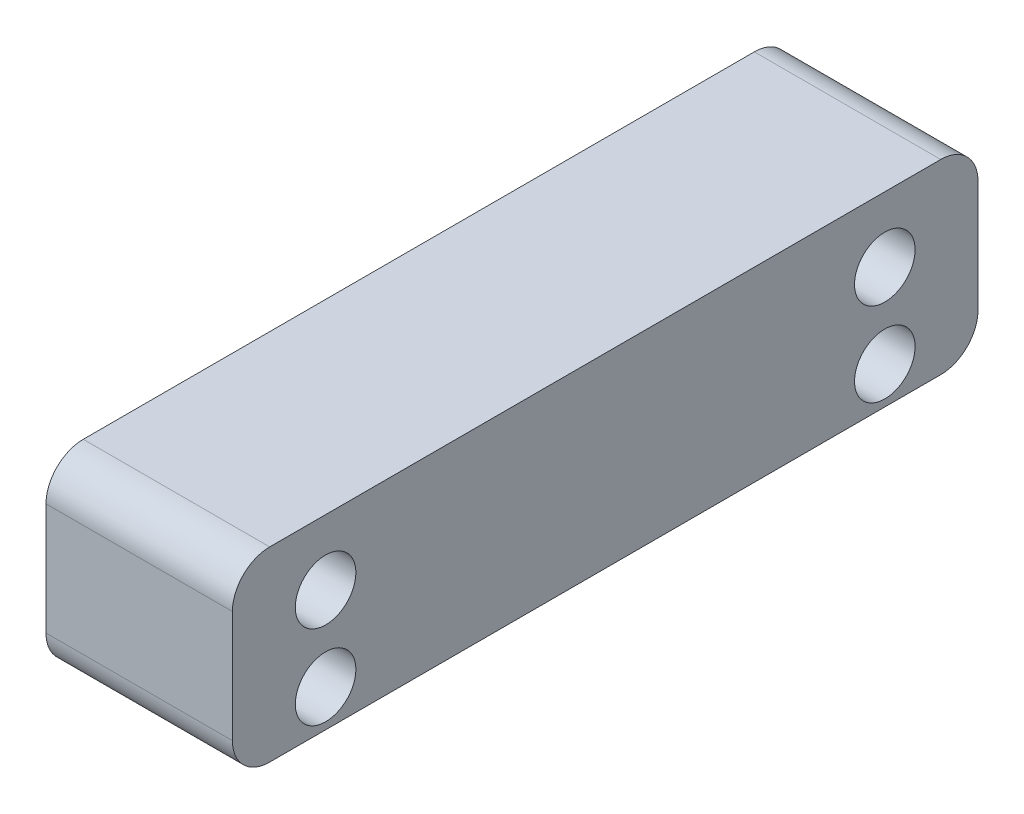
from build123d import *

# Parameters (mm, degrees)
BOSS_EXTRUDE1_DEPTH      = 90
FILLET1_R                = 7.5
FILLET2_R                = 2
SKETCH2_W                = 20
SKETCH2_H                = 80
SKETCH2_W_2              = 32
BOSS_EXTRUDE2_DEPTH      = 20
SKETCH3_R                = 2.5
BOSS_EXTRUDE3_DEPTH      = 111
BOSS_EXTRUDE4_START      = 7.5
SKETCH4_W                = 80
SKETCH4_H                = 20
SKETCH4_R                = 3.25
BOSS_EXTRUDE4_DEPTH      = 20
MOVE_FACE1_BY            = 1.5
MOVE_FACE2_BY            = 1.5
FILLET3_R                = 4
FILLET4_R                = 4
CUT_EXTRUDE1_DEPTH       = 2
BOSS_EXTRUDE5_DEPTH      = 2
SKETCH7_W                = 58
SKETCH7_H                = 15
CUT_EXTRUDE2_DEPTH       = 0.5
SKETCH8_R                = 10
BOSS_EXTRUDE6_DEPTH      = 1.5
SKETCH10_R               = 4.25
SKETCH10_R_2             = 2.75
CUT_EXTRUDE_THIN1_DEPTH  = 1.5
SKETCH11_RX              = 5
SKETCH11_RY              = 2.5
BOSS_EXTRUDE7_DEPTH      = 1.5
LPATTERN1_COUNT          = 3
LPATTERN1_PITCH          = 24
SKETCH12_RX              = 5
SKETCH12_RY              = 2.5
BOSS_EXTRUDE8_DEPTH      = 1.5
LPATTERN2_START          = 113.13708499
LPATTERN2_DEPTH          = 1.5
FILLET7_R                = 7.5
FILLET5_R                = 5
FILLET6_R                = 2
SHELL1_T                 = -1
SKETCH14_R               = 14
BOSS_EXTRUDE9_DEPTH      = 1
BOSS_EXTRUDE10_DEPTH     = 1
BOSS_EXTRUDE11_START     = -30
BOSS_EXTRUDE11_OUTLINE_R = 13
BOSS_EXTRUDE11_DEPTH     = 10
BOSS_EXTRUDE12_REACH     = 233.484
SKETCH18_R               = 3
SKETCH17_W               = 1.5
SKETCH17_H               = 20
SKETCH17_W_2             = 20
SKETCH17_H_2             = 1.5
EXTRUDE_THIN1_DEPTH      = 63.5
SKETCH20_R               = 12.5
BOSS_EXTRUDE13_DEPTH     = 5
FILLET8_R                = 2


# Read off the part's stored shape, not the designer's step: LPattern2, Body-Move/Copy1, Boss-Extrude11
with BuildPart() as part:
    # Sketch1 → Boss-Extrude1 (new, symmetric)
    with BuildSketch(Plane(origin=(0, 0, 0), x_dir=(0, 0, -1), z_dir=(1, 0, 0))):
        Polygon((0, 0), (0, 45), (-115, 45), (-160, 0), align=None)
    extrude(amount=BOSS_EXTRUDE1_DEPTH, both=True)

    # Fillet1
    fillet1_edges = [part.edges().sort_by_distance(p)[0] for p in [
        (0, 0, 160),
        (0, 45, 115),
        (0, 45, 0),
        (0, 0, 0),
    ]]
    fillet(fillet1_edges, radius=FILLET1_R)

    # Fillet2
    fillet2_edges = [part.edges().sort_by_distance(p)[0] for p in [
        (-90, 0, 74.696699141),
        (90, 0, 74.696699141),
        (-90, 27.803300859, 132.196699141),
        (-90, 45, 59.696699141),
        (-90, 22.5, 0),
        (-90, 44.429096494, 114.763524025),
        (-90, 2.196699141, 2.196699141),
        (-90, 42.803300859, 2.196699141),
        (-90, 4.629874257, 148.822494776),
        (90, 27.803300859, 132.196699141),
        (90, 22.5, 0),
        (90, 45, 59.696699141),
        (90, 44.429096494, 114.763524025),
        (90, 2.196699141, 2.196699141),
        (90, 42.803300859, 2.196699141),
        (90, 4.629874257, 148.822494776),
    ]]
    fillet(fillet2_edges, radius=FILLET2_R)

    # Sketch2 → Boss-Extrude2 (add)
    with BuildSketch(Plane(origin=(0, 45, 0), x_dir=(1, 0, 0), z_dir=(0, 1, 0))):
        with Locations((-71.5, -59.696699141)):
            Rectangle(SKETCH2_W, SKETCH2_H)
        with Locations((65.5, -59.696699141)):
            Rectangle(SKETCH2_W_2, SKETCH2_H)
    extrude(amount=BOSS_EXTRUDE2_DEPTH)

    # Sketch3 → Boss-Extrude3 (add)
    with BuildSketch(Plane(origin=(-61.5, 0, 0), x_dir=(0, 0, -1), z_dir=(1, 0, 0))):
        with Locations(Location((-89.696699141, 59.5, 0), (0, 0, 180))):
            Circle(SKETCH3_R)
        with Locations(Location((-89.696699141, 50.5, 0), (0, 0, 180))):
            Circle(SKETCH3_R)
        with Locations(Location((-29.696699141, 50.5, 0), (0, 0, 180))):
            Circle(SKETCH3_R)
        with Locations(Location((-29.696699141, 59.5, 0), (0, 0, 180))):
            Circle(SKETCH3_R)
    extrude(amount=BOSS_EXTRUDE3_DEPTH)

    # Fillet3
    fillet3_edges = [part.edges().sort_by_distance(p)[0] for p in [
        (65.5, 65, 99.696699141),
        (65.5, 65, 19.696699141),
        (-71.5, 65, 99.696699141),
        (-71.5, 65, 19.696699141),
    ]]
    fillet(fillet3_edges, radius=FILLET3_R)

    # Sketch5 → Cut-Extrude1 (cut)
    with BuildSketch(Plane(origin=(0, 80, 80), x_dir=(1, 0, 0), z_dir=(0, 0.7071067811865511, 0.707106781186544))):
        with BuildLine():
            Line((-65, -56.317279836), (65, -56.317279836))
            ThreePointArc((65, -56.317279836), (66.767766953, -57.049512883), (67.5, -58.817279836))
            Line((67.5, -58.817279836), (67.5, -88.817279836))
            ThreePointArc((67.5, -88.817279836), (66.767766953, -90.585046789), (65, -91.317279836))
            Line((65, -91.317279836), (-65, -91.317279836))
            ThreePointArc((-65, -91.317279836), (-66.767766953, -90.585046789), (-67.5, -88.817279836))
            Line((-67.5, -88.817279836), (-67.5, -58.817279836))
            ThreePointArc((-67.5, -58.817279836), (-66.767766953, -57.049512883), (-65, -56.317279836))
        make_face()
    extrude(amount=-CUT_EXTRUDE1_DEPTH, mode=Mode.SUBTRACT)


with BuildPart() as body_2:
    # Sketch4 → Boss-Extrude4 (new body)
    with BuildSketch(Plane(origin=(-61.5, 0, 0), x_dir=(0, 0, -1), z_dir=(1, 0, 0)).offset(BOSS_EXTRUDE4_START)):
        with Locations((-59.696699141, 55)):
            Rectangle(SKETCH4_W, SKETCH4_H)
        with Locations((-89.696699141, 59.5)):
            Circle(SKETCH4_R, mode=Mode.SUBTRACT)
        with Locations((-89.696699141, 50.5)):
            Circle(SKETCH4_R, mode=Mode.SUBTRACT)
        with Locations((-29.696699141, 59.5)):
            Circle(SKETCH4_R, mode=Mode.SUBTRACT)
        with Locations((-29.696699141, 50.5)):
            Circle(SKETCH4_R, mode=Mode.SUBTRACT)
    extrude(amount=BOSS_EXTRUDE4_DEPTH)

    # Move Face1: a face moved outward by 1.5
    extrude(body_2.faces().sort_by_distance((-44, 65, 59.696699141))[0], amount=MOVE_FACE1_BY, dir=(0, 1, 0))

    # Move Face2: a face moved inward by 1.5
    extrude(body_2.faces().sort_by_distance((-44, 45, 59.696699141))[0], amount=MOVE_FACE2_BY, dir=(0, 1, 0), mode=Mode.SUBTRACT)

    # Fillet4
    fillet4_edges = [body_2.edges().sort_by_distance(p)[0] for p in [
        (-44, 66.5, 99.696699141),
        (-44, 66.5, 19.696699141),
        (-44, 46.5, 19.696699141),
        (-44, 46.5, 99.696699141),
    ]]
    fillet(fillet4_edges, radius=FILLET4_R)


with BuildPart() as body_3:
    # Sketch6 → Boss-Extrude5 (new body)
    with BuildSketch(Plane(origin=(0, 78.585786438, 78.585786438), x_dir=(1, 0, 0), z_dir=(0, 0.7071067811865509, 0.7071067811865441))):
        with BuildLine():
            Line((65, -56.317279836), (-65, -56.317279836))
            ThreePointArc((-65, -56.317279836), (-66.767766953, -57.049512883), (-67.5, -58.817279836))
            Line((-67.5, -58.817279836), (-67.5, -88.817279836))
            ThreePointArc((-67.5, -88.817279836), (-66.767766953, -90.585046789), (-65, -91.317279836))
            Line((-65, -91.317279836), (65, -91.317279836))
            ThreePointArc((65, -91.317279836), (66.767766953, -90.585046789), (67.5, -88.817279836))
            Line((67.5, -88.817279836), (67.5, -58.817279836))
            ThreePointArc((67.5, -58.817279836), (66.767766953, -57.049512883), (65, -56.317279836))
        make_face()
    extrude(amount=BOSS_EXTRUDE5_DEPTH)

    # Sketch7 → Cut-Extrude2 (cut)
    with BuildSketch(Plane(origin=(0, 80, 80), x_dir=(1, 0, 0), z_dir=(0, 0.7071067811865509, 0.7071067811865441))):
        with Locations((-28.5, -71.817279836)):
            Rectangle(SKETCH7_W, SKETCH7_H)
    extrude(amount=-CUT_EXTRUDE2_DEPTH, mode=Mode.SUBTRACT)

    # Sketch8 → Boss-Extrude6 (add)
    with BuildSketch(Plane(origin=(0, 80, 80), x_dir=(1, 0, 0), z_dir=(0, 0.7071067811865509, 0.7071067811865441))):
        with Locations(Location((15.5, -71.817279836, 0), (0, 0, 270))):
            Circle(SKETCH8_R)
    extrude(amount=BOSS_EXTRUDE6_DEPTH)

    # Sketch10 → Cut-Extrude-Thin1 (cut)
    # profile 1 of 5: a face of its own
    with BuildSketch(Plane(origin=(0, 81.060660172, 81.060660172), x_dir=(1, 0, 0), z_dir=(0, 0.7071067811865509, 0.7071067811865441))):
        with Locations((15.5, -71.817279836)):
            Circle(SKETCH10_R)
        with Locations((15.5, -71.817279836)):
            Circle(SKETCH10_R_2, mode=Mode.SUBTRACT)
    # profile 2 of 5: a face of its own
    with BuildSketch(Plane(origin=(0, 81.060660172, 81.060660172), x_dir=(1, 0, 0), z_dir=(0, 0.7071067811865509, 0.7071067811865441))):
        Polygon((7.898602102, -65.27654211), (12.49479618, -69.872736188), (13.555456352, -68.812076016), (8.959262274, -64.215881939), align=None)
    # profile 3 of 5: a face of its own
    with BuildSketch(Plane(origin=(0, 81.060660172, 81.060660172), x_dir=(1, 0, 0), z_dir=(0, 0.7071067811865509, 0.7071067811865441))):
        Polygon((22.040737726, -64.215881939), (17.444543648, -68.812076016), (18.50520382, -69.872736188), (23.101397898, -65.27654211), align=None)
    # profile 4 of 5: a face of its own
    with BuildSketch(Plane(origin=(0, 81.060660172, 81.060660172), x_dir=(1, 0, 0), z_dir=(0, 0.7071067811865509, 0.7071067811865441))):
        Polygon((17.444543648, -74.822483656), (22.040737726, -79.418677734), (23.101397898, -78.358017562), (18.50520382, -73.761823485), align=None)
    # profile 5 of 5: a face of its own
    with BuildSketch(Plane(origin=(0, 81.060660172, 81.060660172), x_dir=(1, 0, 0), z_dir=(0, 0.7071067811865509, 0.7071067811865441))):
        Polygon((12.49479618, -73.761823485), (7.898602102, -78.358017562), (8.959262274, -79.418677734), (13.555456352, -74.822483656), align=None)
    extrude(amount=-CUT_EXTRUDE_THIN1_DEPTH, mode=Mode.SUBTRACT)

    # Sketch11 → Boss-Extrude7 (add)
    with BuildSketch(Plane(origin=(0, 80, 80), x_dir=(1, 0, 0), z_dir=(0, 0.7071067811865509, 0.7071067811865441))):
        with Locations((-52.5, -85.317279836)):
            Ellipse(SKETCH11_RX, SKETCH11_RY)
    boss_extrude7 = extrude(amount=BOSS_EXTRUDE7_DEPTH)

    # LPattern1: Boss-Extrude7 ×3
    with Locations(*[(i * LPATTERN1_PITCH, 0, 0) for i in range(1, LPATTERN1_COUNT)]):
        add(boss_extrude7)

    # Sketch12 → Boss-Extrude8 (add)
    with BuildSketch(Plane(origin=(0, 80, 80), x_dir=(1, 0, 0), z_dir=(0, 0.7071067811865509, 0.7071067811865441))):
        with Locations((32.5, -66.317279836)):
            Ellipse(SKETCH12_RX, SKETCH12_RY)
    extrude(amount=BOSS_EXTRUDE8_DEPTH)

    # LPattern2 outline → LPattern2 (add)
    with BuildSketch(Plane(origin=(0, 0, 0), x_dir=(1, 0, 0), z_dir=(0, 0.707106781186551, 0.7071067811865439)).offset(LPATTERN2_START)):
        with BuildLine():
            add(Edge.make_bspline(
                [(37.5, -74.317279836), (37.5, -69.987152818), (30, -72.152216327), (22.5, -74.317279836), (30, -76.482343346), (37.5, -78.647406855), (37.5, -74.317279836)],
                knots=[0, 0, 0, 2.094395102, 2.094395102, 4.188790205, 4.188790205, 6.283185307, 6.283185307, 6.283185307], degree=2, weights=[1, 0.5, 1, 0.5, 1, 0.5, 1]))
        make_face()
        with BuildLine():
            add(Edge.make_bspline(
                [(37.5, -82.317279836), (37.5, -77.987152818), (30, -80.152216327), (22.5, -82.317279836), (30, -84.482343346), (37.5, -86.647406855), (37.5, -82.317279836)],
                knots=[0, 0, 0, 2.094395102, 2.094395102, 4.188790205, 4.188790205, 6.283185307, 6.283185307, 6.283185307], degree=2, weights=[1, 0.5, 1, 0.5, 1, 0.5, 1]))
        make_face()
        with BuildLine():
            add(Edge.make_bspline(
                [(49.5, -66.317279836), (49.5, -61.987152818), (42, -64.152216327), (34.5, -66.317279836), (42, -68.482343346), (49.5, -70.647406855), (49.5, -66.317279836)],
                knots=[0, 0, 0, 2.094395102, 2.094395102, 4.188790205, 4.188790205, 6.283185307, 6.283185307, 6.283185307], degree=2, weights=[1, 0.5, 1, 0.5, 1, 0.5, 1]))
        make_face()
        with BuildLine():
            add(Edge.make_bspline(
                [(49.5, -74.317279836), (49.5, -69.987152818), (42, -72.152216327), (34.5, -74.317279836), (42, -76.482343346), (49.5, -78.647406855), (49.5, -74.317279836)],
                knots=[0, 0, 0, 2.094395102, 2.094395102, 4.188790205, 4.188790205, 6.283185307, 6.283185307, 6.283185307], degree=2, weights=[1, 0.5, 1, 0.5, 1, 0.5, 1]))
        make_face()
        with BuildLine():
            add(Edge.make_bspline(
                [(49.5, -82.317279836), (49.5, -77.987152818), (42, -80.152216327), (34.5, -82.317279836), (42, -84.482343346), (49.5, -86.647406855), (49.5, -82.317279836)],
                knots=[0, 0, 0, 2.094395102, 2.094395102, 4.188790205, 4.188790205, 6.283185307, 6.283185307, 6.283185307], degree=2, weights=[1, 0.5, 1, 0.5, 1, 0.5, 1]))
        make_face()
        with BuildLine():
            add(Edge.make_bspline(
                [(61.5, -66.317279836), (61.5, -61.987152818), (54, -64.152216327), (46.5, -66.317279836), (54, -68.482343346), (61.5, -70.647406855), (61.5, -66.317279836)],
                knots=[0, 0, 0, 2.094395102, 2.094395102, 4.188790205, 4.188790205, 6.283185307, 6.283185307, 6.283185307], degree=2, weights=[1, 0.5, 1, 0.5, 1, 0.5, 1]))
        make_face()
        with BuildLine():
            add(Edge.make_bspline(
                [(61.5, -74.317279836), (61.5, -69.987152818), (54, -72.152216327), (46.5, -74.317279836), (54, -76.482343346), (61.5, -78.647406855), (61.5, -74.317279836)],
                knots=[0, 0, 0, 2.094395102, 2.094395102, 4.188790205, 4.188790205, 6.283185307, 6.283185307, 6.283185307], degree=2, weights=[1, 0.5, 1, 0.5, 1, 0.5, 1]))
        make_face()
        with BuildLine():
            add(Edge.make_bspline(
                [(61.5, -82.317279836), (61.5, -77.987152818), (54, -80.152216327), (46.5, -82.317279836), (54, -84.482343346), (61.5, -86.647406855), (61.5, -82.317279836)],
                knots=[0, 0, 0, 2.094395102, 2.094395102, 4.188790205, 4.188790205, 6.283185307, 6.283185307, 6.283185307], degree=2, weights=[1, 0.5, 1, 0.5, 1, 0.5, 1]))
        make_face()
    extrude(amount=LPATTERN2_DEPTH)


with BuildPart() as body_4:
    # Sketch13 → Revolve1 (revolve)
    with BuildSketch(Plane.XY.offset(59.696699141), mode=Mode.PRIVATE) as revolve1_sk:
        Polygon((11.5, 70), (11.5, 85), (105.301145933, 85), (111.5, 74.263269807), (121.5, 72.5), (121.5, 70), align=None)
    revolve(revolve1_sk.sketch.rotate(Axis((11.5, 70, 59.696699141), (1, 0, 0)), 90), axis=Axis((11.5, 70, 59.696699141), (1, 0, 0)))

    # Fillet5
    fillet5_edges = [body_4.edges().sort_by_distance(p)[0] for p in [
        (105.301145933, 70, 44.696699141),
    ]]
    fillet(fillet5_edges, radius=FILLET5_R)

    # Fillet6
    fillet6_edges = [body_4.edges().sort_by_distance(p)[0] for p in [
        (111.5, 70, 55.433429334),
    ]]
    fillet(fillet6_edges, radius=FILLET6_R)

    # Shell1
    shell1_openings = [body_4.faces().sort_by_distance(p)[0] for p in [
        (121.5, 70, 59.696699141),
        (11.5, 70, 59.696699141),
    ]]
    offset(amount=SHELL1_T, openings=shell1_openings, kind=Kind.INTERSECTION)

    # Sketch14 → Boss-Extrude9 (add)
    with BuildSketch(Plane.ZY.offset(-11.5)):
        with BuildLine():
            Line((55.696699141, 85.491933385), (40.696699141, 81.618950039))
            ThreePointArc((40.696699141, 81.618950039), (31.696699141, 70), (40.696699141, 58.381049961))
            Line((40.696699141, 58.381049961), (55.696699141, 54.508066615))
            ThreePointArc((55.696699141, 54.508066615), (59.696699141, 54), (63.696699141, 54.508066615))
            Line((63.696699141, 54.508066615), (78.696699141, 58.381049961))
            ThreePointArc((78.696699141, 58.381049961), (87.696699141, 70), (78.696699141, 81.618950039))
            Line((78.696699141, 81.618950039), (63.696699141, 85.491933385))
            ThreePointArc((63.696699141, 85.491933385), (59.696699141, 86), (55.696699141, 85.491933385))
        make_face()
        with Locations((59.696699141, 70)):
            Circle(SKETCH14_R, mode=Mode.SUBTRACT)
    extrude(amount=BOSS_EXTRUDE9_DEPTH)


with BuildPart() as body_5:
    # Body-Move/Copy1 outline → Body-Move/Copy1 (revolve)
    with BuildSketch(Plane(origin=(0, 70, 59.696699141), x_dir=(0, 1, 0), z_dir=(0, 0, -1))):
        Polygon((0, 121.5), (0, 11.5), (15, 11.5), (15, 105.301145933), (4.263269807, 111.5), (2.5, 121.5), align=None)
    revolve(axis=Axis((0, 70, 59.696699141), (1, 0, 0)))


with BuildPart() as part_1:
    add(part.part)

    # Combine1: cut body 5
    add(body_5.part, mode=Mode.SUBTRACT)

    # Fillet7
    fillet7_edges = [part_1.edges().sort_by_distance(p)[0] for p in [
        (65.5, 65, 73.838834765),
        (65.5, 65, 45.554563517),
    ]]
    fillet(fillet7_edges, radius=FILLET7_R)

    # Sketch20 → Boss-Extrude13 (add)
    with BuildSketch(Plane.XZ):
        with Locations(Location((-60, 116.893398282, 0), (0, 0, 90))):
            Circle(SKETCH20_R)
        with Locations(Location((-60, 32.5, 0), (0, 0, 90))):
            Circle(SKETCH20_R)
        with Locations(Location((60, 32.5, 0), (0, 0, 90))):
            Circle(SKETCH20_R)
        with Locations(Location((60, 116.893398282, 0), (0, 0, 90))):
            Circle(SKETCH20_R)
    extrude(amount=BOSS_EXTRUDE13_DEPTH)

    # Fillet8
    fillet8_edges = [part_1.edges().sort_by_distance(p)[0] for p in [
        (-60, -5, 104.393398282),
        (-60, -5, 20),
        (60, -5, 20),
        (60, -5, 104.393398282),
    ]]
    fillet(fillet8_edges, radius=FILLET8_R)


with BuildPart() as body_5_2:
    # Sketch15 → Boss-Extrude10 (new body)
    with BuildSketch(Plane(origin=(-34, 0, 0), x_dir=(0, 0, -1), z_dir=(1, 0, 0))):
        with BuildLine():
            Line((-63.696699141, 85.491933385), (-78.696699141, 81.618950039))
            ThreePointArc((-78.696699141, 81.618950039), (-87.696699141, 70), (-78.696699141, 58.381049961))
            Line((-78.696699141, 58.381049961), (-63.696699141, 54.508066615))
            ThreePointArc((-63.696699141, 54.508066615), (-59.696699141, 54), (-55.696699141, 54.508066615))
            Line((-55.696699141, 54.508066615), (-40.696699141, 58.381049961))
            ThreePointArc((-40.696699141, 58.381049961), (-31.696699141, 70), (-40.696699141, 81.618950039))
            Line((-40.696699141, 81.618950039), (-55.696699141, 85.491933385))
            ThreePointArc((-55.696699141, 85.491933385), (-59.696699141, 86), (-63.696699141, 85.491933385))
        make_face()
    extrude(amount=BOSS_EXTRUDE10_DEPTH)


with BuildPart() as body_6:
    # Boss-Extrude11 outline → Boss-Extrude11 (new body)
    with BuildSketch(Plane.ZY.offset(-10.5).offset(BOSS_EXTRUDE11_START)):
        with Locations((59.696699141, 70)):
            Circle(BOSS_EXTRUDE11_OUTLINE_R)
    extrude(amount=BOSS_EXTRUDE11_DEPTH)

    # Sketch18 → Boss-Extrude12 (add, up to next)
    with BuildSketch(Plane(origin=(-33, 0, 0), x_dir=(0, 0, -1), z_dir=(1, 0, 0)), mode=Mode.PRIVATE) as boss_extrude12_sk1:
        with Locations(Location((-59.696699141, 70, 0), (0, 0, 180))):
            Circle(SKETCH18_R)
    boss_extrude12_tool1 = extrude(boss_extrude12_sk1.sketch, amount=BOSS_EXTRUDE12_REACH, mode=Mode.PRIVATE) - body_6.part

    add(body_5_2.part)  # Boss-Extrude12 merges body 5 2
    add(boss_extrude12_tool1.solids().sort_by_distance((-33, 70, 59.696699))[0])

    # Sketch17 → Extrude-Thin1 (add)
    with BuildSketch(Plane(origin=(-33, 0, 0), x_dir=(0, 0, -1), z_dir=(1, 0, 0))):
        with Locations((-59.696699141, 70)):
            Rectangle(SKETCH17_W, SKETCH17_H)
        with Locations((-59.696699141, 70)):
            Rectangle(SKETCH17_W_2, SKETCH17_H_2)
    extrude(amount=EXTRUDE_THIN1_DEPTH)

    # Sketch19 → Cut-Revolve3 (revolve, cut)
    with BuildSketch(Plane.XY.offset(59.696699141), mode=Mode.PRIVATE) as cut_revolve3_sk:
        Polygon((-33, 76.452368755), (-18, 80), (-18, 81.618950039), (-33, 81.618950039), align=None)
    revolve(cut_revolve3_sk.sketch.rotate(Axis((111.5, 70, 59.696699141), (-1, 0, 0)), 270), axis=Axis((111.5, 70, 59.696699141), (-1, 0, 0)), mode=Mode.SUBTRACT)


solid = body_2.part
